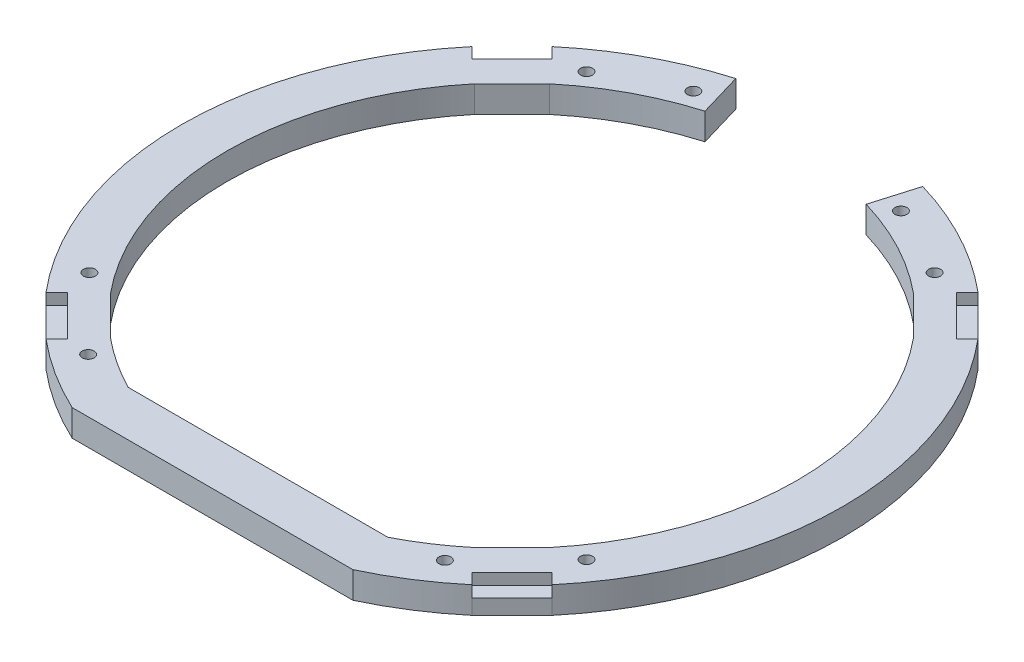
from build123d import *

# Parameters (mm, degrees)
RESSALTO_EXTRUS_O1_DEPTH                = 7
CASCA1_DEPTH                            = 7
FURO_ROSCADO_PARA_CONDU_TE_DE_M3X0_51_D = 3.15
CORTE_EXTRUS_O1_DEPTH                   = 124.517933921
CORTE_EXTRUS_O2_DEPTH                   = 3


# Read off the part's stored shape, not the designer's step: Casca1
with BuildPart() as part:
    # Esboço1 → Ressalto-extrusão1 (new body)
    with BuildSketch(Plane(origin=(0, 0, 0), x_dir=(1, 0, 0), z_dir=(0, 1, 0))):
        with BuildLine():
            Line((-37, -78.961003033), (37, -78.961003033))
            ThreePointArc((37, -78.961003033), (46.963540288, -73.472892169), (56.127920845, -66.734522563))
            Line((56.127920845, -66.734522563), (66.734522563, -56.127920845))
            ThreePointArc((66.734522563, -56.127920845), (87.2, 0), (66.734522563, 56.127920845))
            Line((66.734522563, 56.127920845), (56.127920845, 66.734522563))
            ThreePointArc((56.127920845, 66.734522563), (0, 87.2), (-56.127920845, 66.734522563))
            Line((-56.127920845, 66.734522563), (-66.734522563, 56.127920845))
            ThreePointArc((-66.734522563, 56.127920845), (-87.2, 0), (-66.734522563, -56.127920845))
            Line((-66.734522563, -56.127920845), (-56.127920845, -66.734522563))
            ThreePointArc((-56.127920845, -66.734522563), (-46.963540288, -73.472892169), (-37, -78.961003033))
        make_face()
    extrude(amount=RESSALTO_EXTRUS_O1_DEPTH)

    # Casca1 outline → Casca1 (cut)
    with BuildSketch(Plane(origin=(0, 0, 0), x_dir=(1, 0, 0), z_dir=(0, 1, 0))):
        with BuildLine():
            ThreePointArc((-57.870105501, 48.021775158), (-75.2, 0), (-57.870105501, -48.021775158))
            Line((-57.870105501, -48.021775158), (-48.021775158, -57.870105501))
            ThreePointArc((-48.021775158, -57.870105501), (-41.373205231, -62.795683681), (-34.223735518, -66.961003033))
            Line((-34.223735518, -66.961003033), (34.223735518, -66.961003033))
            ThreePointArc((34.223735518, -66.961003033), (41.373205231, -62.795683681), (48.021775158, -57.870105501))
            Line((48.021775158, -57.870105501), (57.870105501, -48.021775158))
            ThreePointArc((57.870105501, -48.021775158), (75.2, 0), (57.870105501, 48.021775158))
            Line((57.870105501, 48.021775158), (48.021775158, 57.870105501))
            ThreePointArc((48.021775158, 57.870105501), (0, 75.2), (-48.021775158, 57.870105501))
            Line((-48.021775158, 57.870105501), (-57.870105501, 48.021775158))
        make_face()
    extrude(amount=CASCA1_DEPTH, mode=Mode.SUBTRACT)

    # Furo roscado para conduíte de M3x0.51 (through all)
    with Locations(Plane(origin=(0, 7, 0), x_dir=(1, 0, 0), z_dir=(0, 1, 0))):
        with Locations((-27.361611466, 75.175409663), (-47.022820183, -64.72135955), (47.022820183, -64.72135955), (27.361611466, 75.175409663), (-65.532163543, -45.886114908), (-45.886114908, 65.532163543), (65.532163543, -45.886114908), (45.886114908, 65.532163543)):
            Hole(FURO_ROSCADO_PARA_CONDU_TE_DE_M3X0_51_D / 2)

    # Esboço5 → Corte-extrusão1 (cut, through all)
    with BuildSketch(Plane(origin=(0, 7, 0), x_dir=(1, 0, 0), z_dir=(0, 1, 0))):
        with BuildLine():
            Line((-24.644524413, 83.645008318), (-21.253076099, 72.134227357))
            ThreePointArc((-21.253076099, 72.134227357), (0, 75.2), (21.253076099, 72.134227357))
            Line((21.253076099, 72.134227357), (24.644524413, 83.645008318))
            ThreePointArc((24.644524413, 83.645008318), (0, 87.2), (-24.644524413, 83.645008318))
        make_face()
    extrude(amount=-CORTE_EXTRUS_O1_DEPTH, mode=Mode.SUBTRACT)

    # Esboço8 → Corte-extrusão2 (cut)
    with BuildSketch(Plane(origin=(0, 7, 0), x_dir=(1, 0, 0), z_dir=(0, 1, 0))):
        Polygon((-66.734522563, -56.127920845), (-63.906095438, -53.29949372), (-53.29949372, -63.906095438), (-56.127920845, -66.734522563), align=None)
        Polygon((-56.127920845, 66.734522563), (-53.29949372, 63.906095438), (-63.906095438, 53.29949372), (-66.734522563, 56.127920845), align=None)
        Polygon((66.734522563, -56.127920845), (63.906095438, -53.29949372), (53.29949372, -63.906095438), (56.127920845, -66.734522563), align=None)
        Polygon((66.734522563, 56.127920845), (63.906095438, 53.29949372), (53.29949372, 63.906095438), (56.127920845, 66.734522563), align=None)
    extrude(amount=-CORTE_EXTRUS_O2_DEPTH, mode=Mode.SUBTRACT)


solid = part.part
